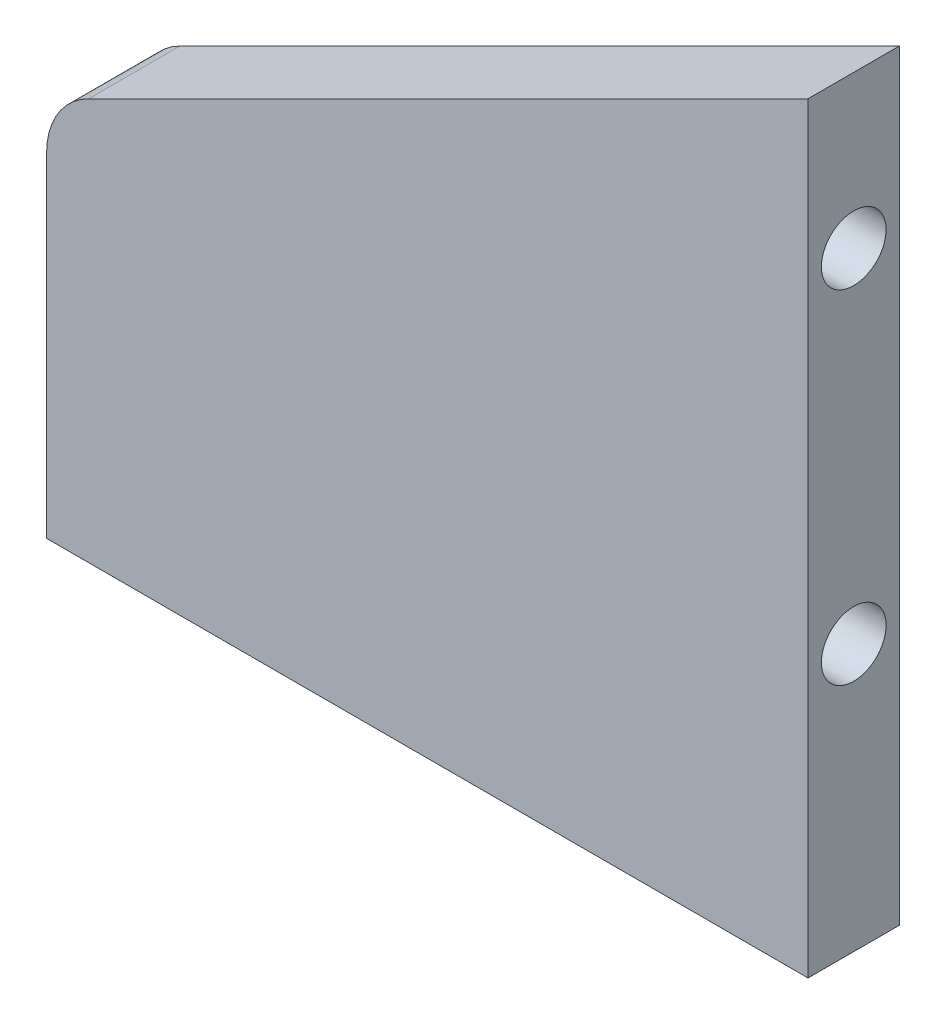
from build123d import *

# Parameters (mm, degrees)
AUFSATZ_LINEAR_AUSTRAGEN1_DEPTH = 12
VERRUNDUNG1_R                   = 10
M10_GEWINDEBOHRUNG1_D           = 8.5
M10_GEWINDEBOHRUNG1_DEPTH       = 27.5
M10_GEWINDEBOHRUNG1_TIP         = 2.553657631
M10_GEWINDEBOHRUNG2_D           = 8.5
M10_GEWINDEBOHRUNG2_DEPTH       = 27.5
M10_GEWINDEBOHRUNG2_TIP         = 2.553657631
M10_GEWINDEBOHRUNG3_D           = 8.5
M10_GEWINDEBOHRUNG3_DEPTH       = 27.5
M10_GEWINDEBOHRUNG3_TIP         = 2.553657631
M10_GEWINDEBOHRUNG4_D           = 8.5
M10_GEWINDEBOHRUNG4_DEPTH       = 25
M10_GEWINDEBOHRUNG4_TIP         = 2.553657631


with BuildPart() as part:
    # Skizze1 → Aufsatz-Linear austragen1 (new body)
    with BuildSketch(Plane.XY):
        Polygon((100, 0), (100, 100), (0, 50), (0, 0), align=None)
    extrude(amount=AUFSATZ_LINEAR_AUSTRAGEN1_DEPTH)

    # Verrundung1
    verrundung1_edges = [part.edges().sort_by_distance(p)[0] for p in [
        (0, 50, 6),
    ]]
    fillet(verrundung1_edges, radius=VERRUNDUNG1_R)

    # M10 Gewindebohrung1
    with Locations(Plane(origin=(0, 0, 0), x_dir=(-1, 0, 0), z_dir=(0, -1, 0))):
        with Locations((-85, -6)):
            Hole(M10_GEWINDEBOHRUNG1_D / 2, depth=M10_GEWINDEBOHRUNG1_DEPTH)
            with Locations((0, 0, -(M10_GEWINDEBOHRUNG1_DEPTH + M10_GEWINDEBOHRUNG1_TIP / 2))):  # 118° drill point
                Cone(0, M10_GEWINDEBOHRUNG1_D / 2, M10_GEWINDEBOHRUNG1_TIP, mode=Mode.SUBTRACT)

    # M10 Gewindebohrung2
    with Locations(Plane(origin=(0, 0, 0), x_dir=(-1, 0, 0), z_dir=(0, -1, 0))):
        with Locations((-15, -6)):
            Hole(M10_GEWINDEBOHRUNG2_D / 2, depth=M10_GEWINDEBOHRUNG2_DEPTH)
            with Locations((0, 0, -(M10_GEWINDEBOHRUNG2_DEPTH + M10_GEWINDEBOHRUNG2_TIP / 2))):  # 118° drill point
                Cone(0, M10_GEWINDEBOHRUNG2_D / 2, M10_GEWINDEBOHRUNG2_TIP, mode=Mode.SUBTRACT)

    # M10 Gewindebohrung3
    with Locations(Plane(origin=(100, 0, 0), x_dir=(0, 0, -1), z_dir=(1, 0, 0))):
        with Locations((-6, 35)):
            Hole(M10_GEWINDEBOHRUNG3_D / 2, depth=M10_GEWINDEBOHRUNG3_DEPTH)
            with Locations((0, 0, -(M10_GEWINDEBOHRUNG3_DEPTH + M10_GEWINDEBOHRUNG3_TIP / 2))):  # 118° drill point
                Cone(0, M10_GEWINDEBOHRUNG3_D / 2, M10_GEWINDEBOHRUNG3_TIP, mode=Mode.SUBTRACT)

    # M10 Gewindebohrung4
    with Locations(Plane(origin=(100, 0, 0), x_dir=(0, 0, -1), z_dir=(1, 0, 0))):
        with Locations((-6, 80)):
            Hole(M10_GEWINDEBOHRUNG4_D / 2, depth=M10_GEWINDEBOHRUNG4_DEPTH)
            with Locations((0, 0, -(M10_GEWINDEBOHRUNG4_DEPTH + M10_GEWINDEBOHRUNG4_TIP / 2))):  # 118° drill point
                Cone(0, M10_GEWINDEBOHRUNG4_D / 2, M10_GEWINDEBOHRUNG4_TIP, mode=Mode.SUBTRACT)


solid = part.part
